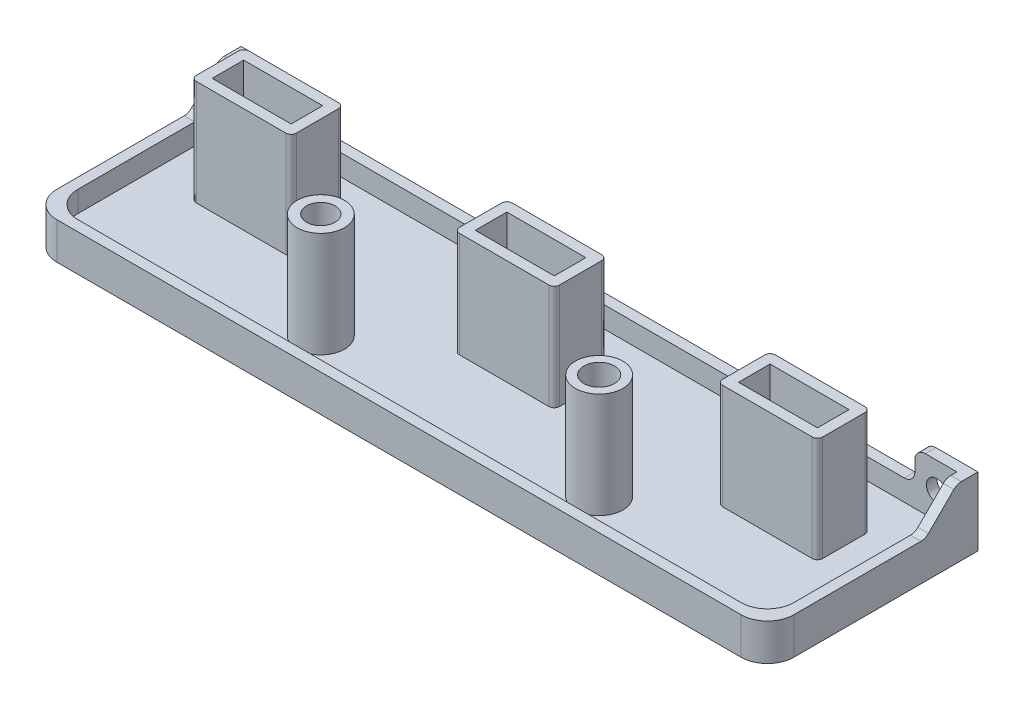
from build123d import *

# Parameters (mm, degrees)
ESQUISSE1_W                      = 140
ESQUISSE1_H                      = 40
BOSS_EXTRU_1_DEPTH               = 3
BOSS_EXTRU_5_DEPTH               = 10
CHANFREIN1_SIZE                  = 6
ESQUISSE15_R                     = 2
ENL_V_MAT_EXTRU_7_DEPTH          = 81.703159789
ESQUISSE18_W                     = 60
ESQUISSE18_H                     = 2
BOSS_EXTRU_6_DEPTH               = 4
CONG_2_R                         = 5
CONG_3_R                         = 2
SYM_TRIE1_OUTLINE_W              = 4
SYM_TRIE1_OUTLINE_H              = 2
SYM_TRIE1_DEPTH                  = 62.191181732
SYM_TRIE1_START                  = 68
SYM_TRIE1_2_DEPTH                = 2
SYM_TRIE1_START_2                = 66.191181932
SYM_TRIE1_3_OUTLINE_W            = 10
SYM_TRIE1_3_OUTLINE_H            = 2
SYM_TRIE1_3_OUTLINE_W_2          = 4
SYM_TRIE1_3_DEPTH                = 1.808818068
SYM_TRIE1_START_3                = 62
SYM_TRIE1_4_OUTLINE_W            = 4
SYM_TRIE1_4_OUTLINE_H            = 2
SYM_TRIE1_4_DEPTH                = 6
SYM_TRIE1_5_OUTLINE_W            = 6
SYM_TRIE1_5_OUTLINE_H            = 2
SYM_TRIE1_5_DEPTH                = 0.191181732
SYM_TRIE1_START_4                = -20
SYM_TRIE1_6_DEPTH                = 2
SYM_TRIE1_START_5                = 2
SYM_TRIE1_7_DEPTH                = 5
CONG_4_R                         = 5
ESQUISSE2_W                      = 19
ESQUISSE2_H                      = 10
BOSS_EXTRU_7_DEPTH               = 20
ESQUISSE19_W                     = 15
ESQUISSE19_H                     = 6
ENL_V_MAT_EXTRU_8_DEPTH          = 77.347887987
CONG_5_R                         = 1
R_P_TITION_LIN_AIRE1_COUNT       = 3
R_P_TITION_LIN_AIRE1_PITCH       = 50
CONG_5_OF_R_P_TITION_LIN_AIRE1_R = 1
ESQUISSE23_R                     = 4.5
BOSS_EXTRU_9_DEPTH               = 20
ESQUISSE24_R                     = 2.70848906
ESQUISSE24_R_2                   = 2.902672956
ENL_V_MAT_EXTRU_10_DEPTH         = 77.347887987


with BuildPart() as part:
    # Esquisse1 → Boss.-Extru.1 (new body)
    with BuildSketch(Plane(origin=(0, 0, 0), x_dir=(1, 0, 0), z_dir=(0, 1, 0))):
        Rectangle(ESQUISSE1_W, ESQUISSE1_H)
    extrude(amount=BOSS_EXTRU_1_DEPTH)

    # Esquisse13 → Boss.-Extru.5 (add)
    with BuildSketch(Plane(origin=(0, 3, 0), x_dir=(1, 0, 0), z_dir=(0, 1, 0))):
        Polygon((-70, 20), (-60, 20), (-60, 18), (-68, 18), (-68, 10), (-70, 10), align=None)
    extrude(amount=BOSS_EXTRU_5_DEPTH)

    # Chanfrein1
    chanfrein1_edges = [part.edges().sort_by_distance(p)[0] for p in [
        (-69, 13, -10),
    ]]
    chamfer(chanfrein1_edges, length=CHANFREIN1_SIZE)

    # Esquisse15 → Enlèv. mat.-Extru.7 (cut, through all)
    with BuildSketch(Plane.XY.offset(-18)):
        with Locations((-64.191181832, 8)):
            Circle(ESQUISSE15_R)
    extrude(amount=-ENL_V_MAT_EXTRU_7_DEPTH, mode=Mode.SUBTRACT)

    # Esquisse18 → Boss.-Extru.6 (add)
    with BuildSketch(Plane(origin=(0, 3, 0), x_dir=(1, 0, 0), z_dir=(0, 1, 0))):
        Polygon((-68, 10), (-68, -18), (0, -18), (0, -20), (-70, -20), (-70, 10), align=None)
        with Locations((-30, 19)):
            Rectangle(ESQUISSE18_W, ESQUISSE18_H)
    extrude(amount=BOSS_EXTRU_6_DEPTH)

    # Congé2
    cong_2_edges = [part.edges().sort_by_distance(p)[0] for p in [
        (-68, 5, 18),
        (-70, 3.5, 20),
    ]]
    fillet(cong_2_edges, radius=CONG_2_R)

    # Congé3
    cong_3_edges = [part.edges().sort_by_distance(p)[0] for p in [
        (-60, 13, -19),
        (-69, 13, -16),
        (-69, 7, -10),
        (-60, 7, -19),
    ]]
    fillet(cong_3_edges, radius=CONG_3_R)

    # Symétrie1: read off the stored shape, not the designer's step
    # Symétrie1 outline → Symétrie1 (add)
    with BuildSketch(Plane.YZ):
        with Locations((5, -19)):
            Rectangle(SYM_TRIE1_OUTLINE_W, SYM_TRIE1_OUTLINE_H)
        with Locations((5, 19)):
            Rectangle(SYM_TRIE1_OUTLINE_W, SYM_TRIE1_OUTLINE_H)
    extrude(amount=SYM_TRIE1_DEPTH)

    # Sym_trie1 2 outline → Sym_trie1 2 (add)
    with BuildSketch(Plane.YZ.offset(SYM_TRIE1_START)):
        with BuildLine():
            Line((13, -20), (13, -16.828427125))
            ThreePointArc((13, -16.828427125), (12.847759065, -16.06306026), (12.414213562, -15.414213562))
            Line((12.414213562, -15.414213562), (7.585786438, -10.585786438))
            ThreePointArc((7.585786438, -10.585786438), (7.152240935, -9.93693974), (7, -9.171572875))
            Line((7, -9.171572875), (7, 20))
            Line((7, 20), (3, 20))
            Line((3, 20), (3, -20))
            Line((3, -20), (13, -20))
        make_face()
    extrude(amount=SYM_TRIE1_2_DEPTH)

    # Sym_trie1 3 outline → Sym_trie1 3 (add)
    with BuildSketch(Plane.YZ.offset(SYM_TRIE1_START_2)):
        with Locations((8, -19)):
            Rectangle(SYM_TRIE1_3_OUTLINE_W, SYM_TRIE1_3_OUTLINE_H)
        with Locations((5, 19)):
            Rectangle(SYM_TRIE1_3_OUTLINE_W_2, SYM_TRIE1_3_OUTLINE_H)
    extrude(amount=SYM_TRIE1_3_DEPTH)

    # Sym_trie1 4 outline → Sym_trie1 4 (add)
    with BuildSketch(Plane.YZ.offset(SYM_TRIE1_START_3)):
        with Locations((5, 19)):
            Rectangle(SYM_TRIE1_4_OUTLINE_W, SYM_TRIE1_4_OUTLINE_H)
    extrude(amount=SYM_TRIE1_4_DEPTH)

    # Sym_trie1 5 outline → Sym_trie1 5 (add)
    with BuildSketch(Plane.YZ.offset(SYM_TRIE1_START_3)):
        with Locations((10, -19)):
            Rectangle(SYM_TRIE1_5_OUTLINE_W, SYM_TRIE1_5_OUTLINE_H)
    extrude(amount=SYM_TRIE1_5_DEPTH)

    # Sym_trie1 6 outline → Sym_trie1 6 (add)
    with BuildSketch(Plane.XY.offset(SYM_TRIE1_START_4)):
        with BuildLine():
            ThreePointArc((62, 13), (60.585786438, 12.414213562), (60, 11))
            Line((60, 11), (60, 9))
            ThreePointArc((60, 9), (59.414213562, 7.585786438), (58, 7))
            Line((58, 7), (62, 7))
            Line((62, 7), (62, 13))
        make_face()
        with BuildLine():
            Line((66.191181932, 13), (62.191181732, 13))
            Line((62.191181732, 13), (62.191181832, 8))
            ThreePointArc((62.191181832, 8), (64.191181832, 10), (66.191181832, 8))
            Line((66.191181832, 8), (66.191181932, 13))
        make_face()
        with BuildLine():
            Line((62.191181832, 8), (62.191181732, 3))
            Line((62.191181732, 3), (66.191181932, 3))
            Line((66.191181932, 3), (66.191181832, 8))
            ThreePointArc((66.191181832, 8), (64.191181832, 6), (62.191181832, 8))
        make_face()
    extrude(amount=SYM_TRIE1_6_DEPTH)

    # Sym_trie1 7 outline → Sym_trie1 7 (add)
    with BuildSketch(Plane(origin=(0, 0, 0), x_dir=(1, 0, 0), z_dir=(0, 1, 0)).offset(SYM_TRIE1_START_5)):
        with BuildLine():
            Line((68, -18), (68, -13))
            ThreePointArc((68, -13), (66.535533906, -16.535533906), (63, -18))
            Line((63, -18), (68, -18))
        make_face()
    extrude(amount=SYM_TRIE1_7_DEPTH)

    # Congé4
    cong_4_edges = [part.edges().sort_by_distance(p)[0] for p in [
        (70, 3.5, 20),
    ]]
    fillet(cong_4_edges, radius=CONG_4_R)

    # Esquisse2 → Boss.-Extru.7 (add)
    with BuildSketch(Plane(origin=(0, 3, 0), x_dir=(1, 0, 0), z_dir=(0, 1, 0))):
        with Locations((-50, 5)):
            Rectangle(ESQUISSE2_W, ESQUISSE2_H)
    boss_extru_7 = extrude(amount=BOSS_EXTRU_7_DEPTH)

    # Esquisse19 → Enlèv. mat.-Extru.8 (cut, through all)
    with BuildSketch(Plane(origin=(0, 23, 0), x_dir=(1, 0, 0), z_dir=(0, 1, 0))):
        with Locations((-50, 5)):
            Rectangle(ESQUISSE19_W, ESQUISSE19_H)
    enl_v_mat_extru_8 = extrude(amount=-ENL_V_MAT_EXTRU_8_DEPTH, mode=Mode.SUBTRACT)

    # Congé5
    cong_5_edges = [part.edges().sort_by_distance(p)[0] for p in [
        (-40.5, 13, 0),
        (-40.5, 13, -10),
        (-59.5, 13, -10),
        (-59.5, 13, 0),
    ]]
    fillet(cong_5_edges, radius=CONG_5_R)

    # Répétition linéaire1: Boss.-Extru.7, Enlèv. mat.-Extru.8 ×3
    with Locations(*[(i * R_P_TITION_LIN_AIRE1_PITCH, 0, 0) for i in range(1, R_P_TITION_LIN_AIRE1_COUNT)]):
        add(boss_extru_7)
        add(enl_v_mat_extru_8, mode=Mode.SUBTRACT)

    # Congé5 of Répétition linéaire1
    cong_5_of_r_p_tition_lin_aire1_edges = [part.edges().sort_by_distance(p)[0] for p in [
        (9.5, 13, 0),
        (9.5, 13, -10),
        (-9.5, 13, -10),
        (-9.5, 13, 0),
        (59.5, 13, 0),
        (59.5, 13, -10),
        (40.5, 13, -10),
        (40.5, 13, 0),
    ]]
    fillet(cong_5_of_r_p_tition_lin_aire1_edges, radius=CONG_5_OF_R_P_TITION_LIN_AIRE1_R)

    # Esquisse23 → Boss.-Extru.9 (add)
    with BuildSketch(Plane(origin=(0, 3, 0), x_dir=(1, 0, 0), z_dir=(0, 1, 0))):
        with Locations(Location((-24.856422556, -10, 0), (0, 0, 270))):
            Circle(ESQUISSE23_R)
        with Locations(Location((28.032520994, -10, 0), (0, 0, 270))):
            Circle(ESQUISSE23_R)
    extrude(amount=BOSS_EXTRU_9_DEPTH)

    # Esquisse24 → Enlèv. mat.-Extru.10 (cut, through all)
    with BuildSketch(Plane(origin=(0, 23, 0), x_dir=(1, 0, 0), z_dir=(0, 1, 0))):
        with Locations(Location((-24.856422556, -10, 0), (0, 0, 270))):
            Circle(ESQUISSE24_R)
        with Locations(Location((28.032520994, -10, 0), (0, 0, 270))):
            Circle(ESQUISSE24_R_2)
    extrude(amount=-ENL_V_MAT_EXTRU_10_DEPTH, mode=Mode.SUBTRACT)


solid = part.part
